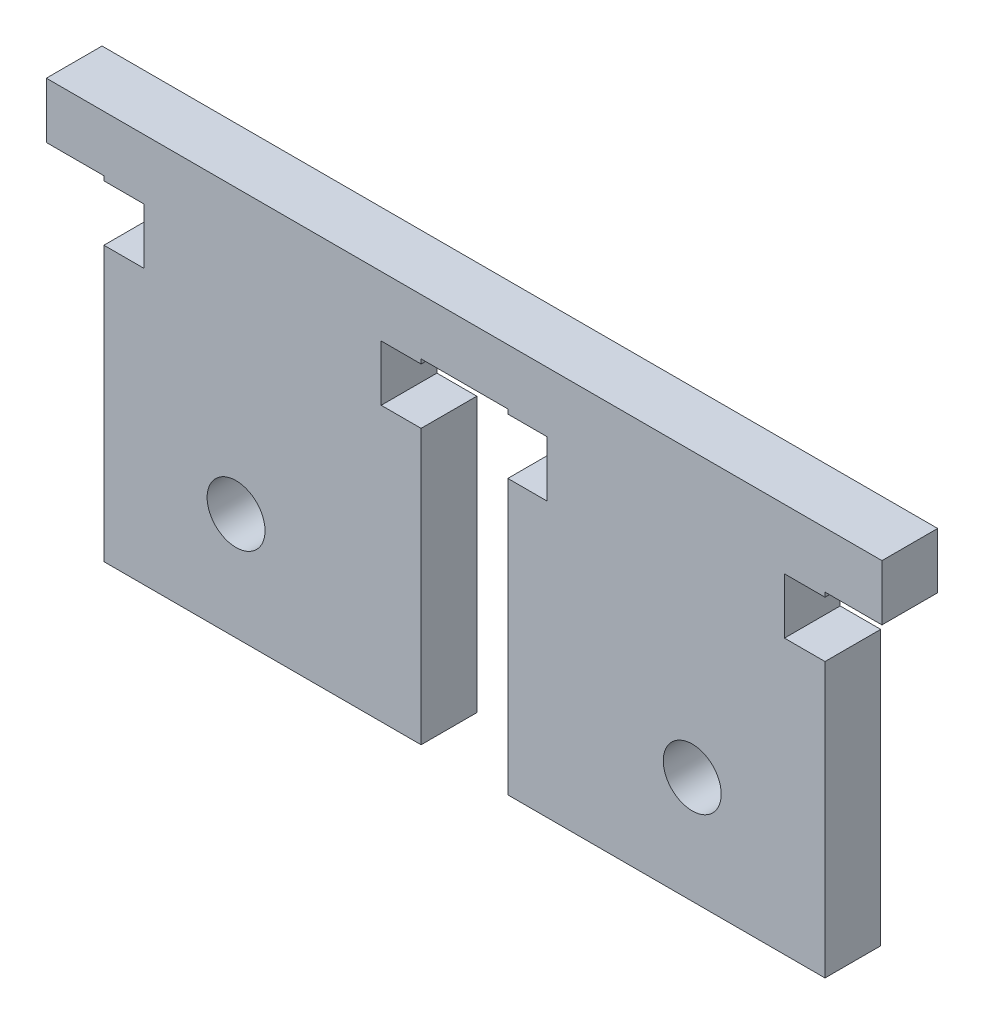
from build123d import *

# Parameters (mm, degrees)
SKETCH3_W           = 95.25
SKETCH3_H           = 60.96
BOSS_EXTRUDE1_DEPTH = 6.35
SKETCH4_W           = 6.56336
SKETCH4_H           = 45.72
SKETCH4_W_2         = 9.8836988
SKETCH4_W_3         = 6.49224
CUT_EXTRUDE1_DEPTH  = 6.35
SKETCH5_W           = 11.143662159
SKETCH5_H           = 6.35
SKETCH5_W_2         = 4.7625
CUT_EXTRUDE2_DEPTH  = 6.35
SKETCH9_W           = 95.25
SKETCH9_H           = 6.35
CUT_EXTRUDE6_DEPTH  = 8.89
SKETCH10_R          = 3.301496283
CUT_EXTRUDE7_DEPTH  = 6.35
SKETCH11_W          = 82.1944
SKETCH11_H          = 6.35
CUT_EXTRUDE9_DEPTH  = 7.62


with BuildPart() as part:
    # Sketch3 → Boss-Extrude1 (new body)
    with BuildSketch(Plane.XY):
        Rectangle(SKETCH3_W, SKETCH3_H)
    extrude(amount=BOSS_EXTRUDE1_DEPTH)

    # Sketch4 → Cut-Extrude1 (cut)
    with BuildSketch(Plane.XY.offset(6.35)):
        with Locations((-44.34332, -7.62)):
            Rectangle(SKETCH4_W, SKETCH4_H)
        with Locations((0.03556, -7.62)):
            Rectangle(SKETCH4_W_2, SKETCH4_H)
        with Locations((44.37888, -7.62)):
            Rectangle(SKETCH4_W_3, SKETCH4_H)
    extrude(amount=-CUT_EXTRUDE1_DEPTH, mode=Mode.SUBTRACT)

    # Sketch5 → Cut-Extrude2 (cut)
    with BuildSketch(Plane.XY.offset(6.35)):
        with Locations((-42.08433108, 11.557)):
            Rectangle(SKETCH5_W, SKETCH5_H)
        with Locations((-7.0741794, 11.557)):
            Rectangle(SKETCH5_W_2, SKETCH5_H)
    cut_extrude2 = extrude(amount=-CUT_EXTRUDE2_DEPTH, mode=Mode.SUBTRACT)

    # Mirror1: Cut-Extrude2 across plane
    add(cut_extrude2.mirror(Plane(origin=(0, 0, 0), x_dir=(0, 0, 1), z_dir=(1, 0, 0))), mode=Mode.SUBTRACT)

    # Sketch9 → Cut-Extrude6 (cut)
    with BuildSketch(Plane(origin=(0, 30.48, 0), x_dir=(1, 0, 0), z_dir=(0, 1, 0))):
        with Locations((0, -3.175)):
            Rectangle(SKETCH9_W, SKETCH9_H)
    extrude(amount=-CUT_EXTRUDE6_DEPTH, mode=Mode.SUBTRACT)

    # Sketch10 → Cut-Extrude7 (cut)
    with BuildSketch(Plane.XY.offset(6.35)):
        with Locations((-26, -10.6279)):
            Circle(SKETCH10_R)
        with Locations((26, -10.6279)):
            Circle(SKETCH10_R)
    extrude(amount=-CUT_EXTRUDE7_DEPTH, mode=Mode.SUBTRACT)

    # Sketch11 → Cut-Extrude9 (cut)
    with BuildSketch(Plane.XZ.offset(30.48)):
        with Locations((0.03556, 3.175)):
            Rectangle(SKETCH11_W, SKETCH11_H)
    extrude(amount=-CUT_EXTRUDE9_DEPTH, mode=Mode.SUBTRACT)


solid = part.part
